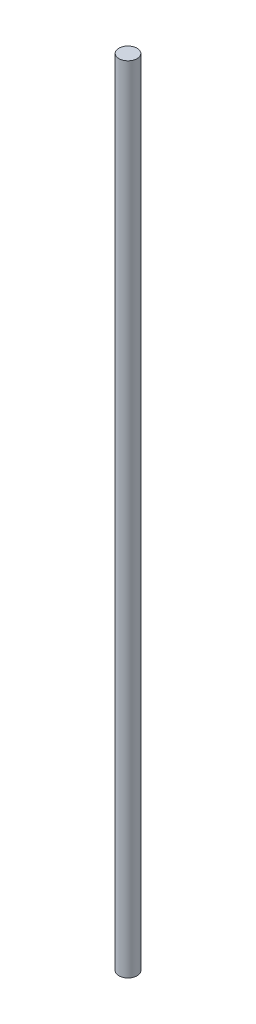
from build123d import *

# Parameters (mm, degrees)
SKETCH1_R           = 4
BOSS_EXTRUDE1_DEPTH = 350


with BuildPart() as part:
    # Sketch1 → Boss-Extrude1 (new body)
    with BuildSketch(Plane(origin=(0, 0, 0), x_dir=(1, 0, 0), z_dir=(0, 1, 0))):
        Circle(SKETCH1_R)
    extrude(amount=-BOSS_EXTRUDE1_DEPTH)


solid = part.part
